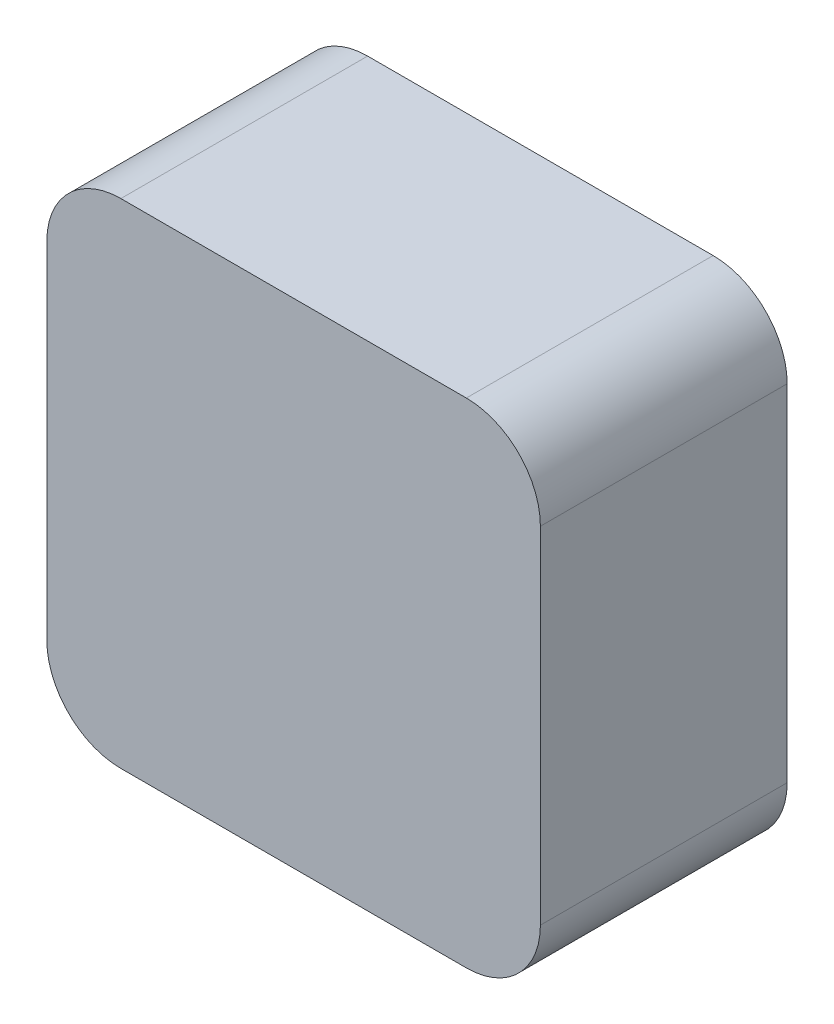
from build123d import *

# Parameters (mm, degrees)
SKETCH1_W           = 10
SKETCH1_H           = 10
SKETCH1_R           = 1.5
BOSS_EXTRUDE1_DEPTH = 5
FILLET1_R           = 1.5
SKETCH2_R           = 1.6
BOSS_EXTRUDE2_DEPTH = 1
SKETCH3_R           = 2.25
CUT_EXTRUDE1_DEPTH  = 3


with BuildPart() as part:
    # Sketch1 → Boss-Extrude1 (new body)
    with BuildSketch(Plane.XY):
        with Locations((-140, 155.5)):
            Rectangle(SKETCH1_W, SKETCH1_H)
        with Locations((-140, 155.5)):
            Circle(SKETCH1_R, mode=Mode.SUBTRACT)
    extrude(amount=BOSS_EXTRUDE1_DEPTH)

    # Fillet1
    fillet1_edges = [part.edges().sort_by_distance(p)[0] for p in [
        (-145, 150.5, 2.5),
        (-145, 160.5, 2.5),
        (-135, 160.5, 2.5),
        (-135, 150.5, 2.5),
    ]]
    fillet(fillet1_edges, radius=FILLET1_R)

    # Sketch2 → Boss-Extrude2 (add)
    with BuildSketch(Plane.XY.offset(5)):
        with Locations((-140, 155.5)):
            Circle(SKETCH2_R)
    extrude(amount=-BOSS_EXTRUDE2_DEPTH)

    # Sketch3 → Cut-Extrude1 (cut)
    with BuildSketch(Plane(origin=(0, 0, 0), x_dir=(-1, 0, 0), z_dir=(0, 0, -1))):
        with Locations((140, 155.5)):
            Circle(SKETCH3_R)
    extrude(amount=-CUT_EXTRUDE1_DEPTH, mode=Mode.SUBTRACT)


solid = part.part
